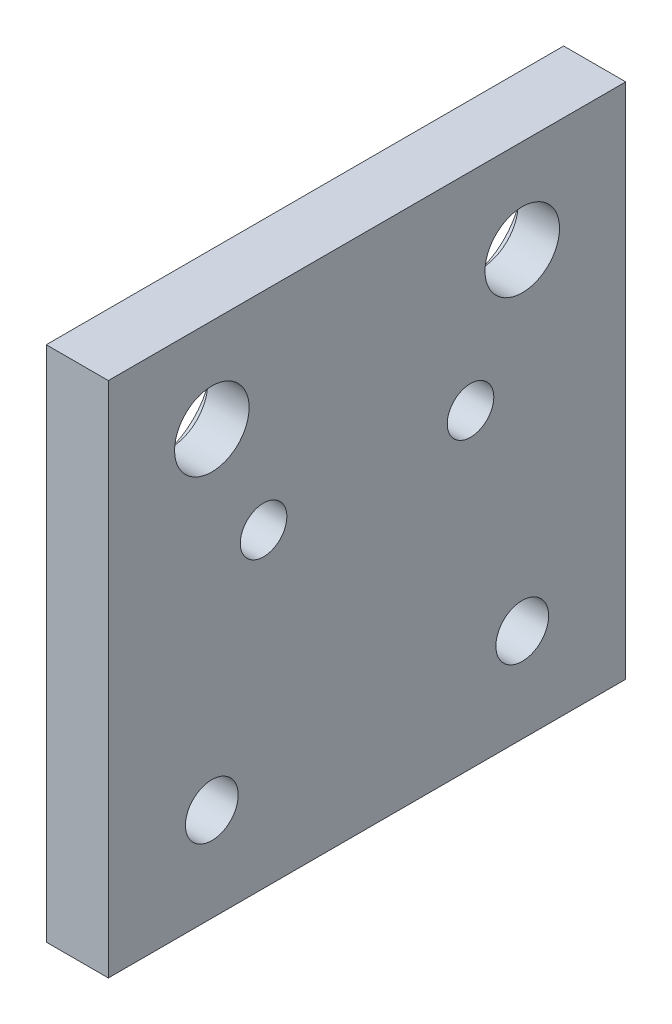
from build123d import *

# Parameters (mm, degrees)
SKETCH2_W            = 50
SKETCH2_H            = 50
BOSS_EXTRUDE1_DEPTH  = 6
SKETCH6_R            = 3.6
SKETCH6_R_2          = 2.55
CUT_EXTRUDE2_DEPTH   = 36.860842154
SKETCH7_R            = 5.05
SKETCH7_R_2          = 6
CUT_EXTRUDE3_DEPTH   = 2
M4_CLEARANCE_HOLE1_D = 4.5


with BuildPart() as part:
    # Sketch2 → Boss-Extrude1 (new body)
    with BuildSketch(Plane(origin=(0, 0, 0), x_dir=(0, 0, -1), z_dir=(1, 0, 0))):
        Rectangle(SKETCH2_W, SKETCH2_H)
    extrude(amount=BOSS_EXTRUDE1_DEPTH)

    # Sketch6 → Cut-Extrude2 (cut, through all)
    with BuildSketch(Plane(origin=(0, 0, 0), x_dir=(0, 0, -1), z_dir=(1, 0, 0))):
        with Locations((-15, 15.95)):
            Circle(SKETCH6_R)
        with Locations((15, 15.95)):
            Circle(SKETCH6_R)
        with Locations((-15, -15.95)):
            Circle(SKETCH6_R_2)
        with Locations((15, -15.95)):
            Circle(SKETCH6_R_2)
    extrude(amount=CUT_EXTRUDE2_DEPTH, mode=Mode.SUBTRACT)

    # Sketch7 → Cut-Extrude3 (cut)
    with BuildSketch(Plane.ZY):
        with Locations((-15, -15.95)):
            Circle(SKETCH7_R)
        with Locations((15, -15.95)):
            Circle(SKETCH7_R)
        with Locations((-15, 15.95)):
            Circle(SKETCH7_R_2)
        with Locations((15, 15.95)):
            Circle(SKETCH7_R_2)
    extrude(amount=-CUT_EXTRUDE3_DEPTH, mode=Mode.SUBTRACT)

    # M4 Clearance Hole1 (through all)
    with Locations(Plane(origin=(6, 0, 0), x_dir=(0, 0, -1), z_dir=(1, 0, 0))):
        with Locations((-10, 5), (10, 5)):
            Hole(M4_CLEARANCE_HOLE1_D / 2)


solid = part.part
